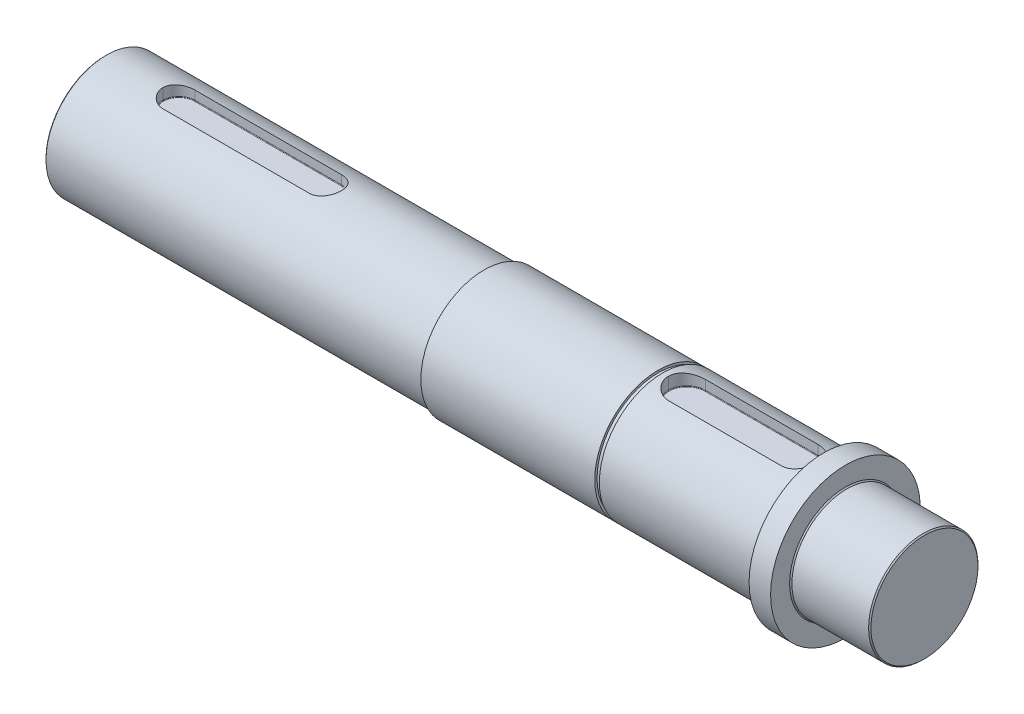
from build123d import *

# Parameters (mm, degrees)
SMUSSO1_SIZE                  = 0.5
SMUSSO2_SIZE                  = 1
TAGLIO_ESTRUSIONE1_DEPTH      = 16
TAGLIO_ESTRUSIONE1_DEPTH_BACK = 16
SCHIZZO2_W                    = 130
SCHIZZO2_H                    = 18
RACCORDO1_R                   = 0.5
RACCORDO2_R                   = 16
RACCORDO3_R                   = 2
SCHIZZO3_W                    = 4
SCHIZZO3_H                    = 18.361474643
SCHIZZO6_R                    = 52.5
ESTRUSIONE_ESTRUSIONE1_DEPTH  = 70
TAGLIO_ESTRUSIONE2_DEPTH      = 14
TAGLIO_ESTRUSIONE2_DEPTH_BACK = 14
SCHIZZO4_W                    = 155
SCHIZZO4_H                    = 16
RACCORDO4_R                   = 14
RACCORDO5_R                   = 0.5
ESTRUSIONE_ESTRUSIONE2_START  = 13
SCHIZZO7_R                    = 47.5
ESTRUSIONE_ESTRUSIONE2_DEPTH  = 13
SMUSSO3_SIZE                  = 1


with BuildPart() as part:
    # Schizzo1 → Rivoluzione1 (revolve)
    with BuildSketch(Plane.XY, mode=Mode.PRIVATE) as rivoluzione1_sk:
        Polygon((0, 0), (0, 52.5), (259, 52.5), (259, 55), (554, 55), (554, 65), (572.7, 65), (572.7, 47.5), (628.3, 47.5), (628.3, 0), align=None)
    revolve(rivoluzione1_sk.sketch.rotate(Axis((-197.2323049, 0, 0), (1, 0, 0)), 90), axis=Axis((-197.2323049, 0, 0), (1, 0, 0)))

    # Smusso1
    smusso1_edges = [part.edges().sort_by_distance(p)[0] for p in [
        (259, 0, -52.5),
    ]]
    chamfer(smusso1_edges, length=SMUSSO1_SIZE)

    # Smusso2
    smusso2_edges = [part.edges().sort_by_distance(p)[0] for p in [
        (572.7, 0, -47.5),
    ]]
    chamfer(smusso2_edges, length=SMUSSO2_SIZE)

    # Schizzo2 → Taglio-Estrusione1 (cut, two sides: drawn at the far end of the back side and taken through both)
    with BuildSketch(Plane.XY.offset(-TAGLIO_ESTRUSIONE1_DEPTH_BACK)):
        with Locations((484, 53)):
            Rectangle(SCHIZZO2_W, SCHIZZO2_H)
    extrude(amount=TAGLIO_ESTRUSIONE1_DEPTH + TAGLIO_ESTRUSIONE1_DEPTH_BACK, mode=Mode.SUBTRACT)

    # Raccordo1
    raccordo1_edges = [part.edges().sort_by_distance(p)[0] for p in [
        (549, 44, 0),
        (484, 44, 16),
        (419, 44, 0),
        (484, 44, -16),
    ]]
    fillet(raccordo1_edges, radius=RACCORDO1_R)

    # Raccordo2
    # the kernel refuses this fillet: 16 mm, written as the material it adds along each edge
    with BuildSketch(Plane(origin=(533, 44, 0), x_dir=(1, 0, 0), z_dir=(0, 0, -1))) as raccordo2_piece_1:
        with BuildLine():
            CenterArc((15.5, -0.5), 0.5, 0, 90)
            Line((16, -0.5), (16, 0))
            Line((16, 0), (15.5, 0))
        make_face()
    revolve(axis=Axis((533, 44, 0), (0, -1, 0)), revolution_arc=90)
    with BuildSketch(Plane(origin=(435, 44, 0), x_dir=(-1, 0, 0), z_dir=(0, 0, 1))) as raccordo2_piece_2:
        with BuildLine():
            CenterArc((15.5, -0.5), 0.5, 0, 90)
            Line((16, -0.5), (16, 0))
            Line((16, 0), (15.5, 0))
        make_face()
    revolve(axis=Axis((435, 44, 0), (0, -1, 0)), revolution_arc=90)
    with BuildSketch(Plane(origin=(435, 44, 0), x_dir=(0, 0, 1), z_dir=(1, 0, 0))) as raccordo2_piece_3:
        with BuildLine():
            CenterArc((15.5, -0.5), 0.5, 0, 90)
            Line((16, -0.5), (16, 0))
            Line((16, 0), (15.5, 0))
        make_face()
    revolve(axis=Axis((435, 44, 0), (0, -1, 0)), revolution_arc=90)
    with BuildSketch(Plane(origin=(533, 44, 0), x_dir=(0, 0, -1), z_dir=(-1, 0, 0))) as raccordo2_piece_4:
        with BuildLine():
            CenterArc((15.5, -0.5), 0.5, 0, 90)
            Line((16, -0.5), (16, 0))
            Line((16, 0), (15.5, 0))
        make_face()
    revolve(axis=Axis((533, 44, 0), (0, -1, 0)), revolution_arc=90)
    with BuildSketch(Plane(origin=(549, 92.621288468, -16), x_dir=(-1, 0, 0), z_dir=(0, -1, 0))) as raccordo2_piece_5_section:
        with BuildLine():
            CenterArc((RACCORDO2_R, -RACCORDO2_R), RACCORDO2_R, 90, 90)
            Line((0, -RACCORDO2_R), (0, 0))
            Line((0, 0), (RACCORDO2_R, 0))
        make_face()
    raccordo2_piece_5 = extrude(amount=48.621288468, mode=Mode.PRIVATE)
    raccordo2_piece_5 = raccordo2_piece_5 & Plane(origin=(545.534076623, 0, 0), x_dir=(0, 0, 1), z_dir=(1, 0, 0)) * Cylinder(55, 162, mode=Mode.PRIVATE)
    add(raccordo2_piece_5)
    with BuildSketch(Plane(origin=(419, 44, 16), x_dir=(0, 0, -1), z_dir=(0, 1, 0))) as raccordo2_piece_6_section:
        with BuildLine():
            CenterArc((RACCORDO2_R, -RACCORDO2_R), RACCORDO2_R, 90, 90)
            Line((0, -RACCORDO2_R), (0, 0))
            Line((0, 0), (RACCORDO2_R, 0))
        make_face()
    raccordo2_piece_6 = extrude(amount=48.621288468, mode=Mode.PRIVATE)
    raccordo2_piece_6 = raccordo2_piece_6 & Plane(origin=(422.465920441, 0, 0), x_dir=(0, 0, 1), z_dir=(1, 0, 0)) * Cylinder(55, 162, mode=Mode.PRIVATE)
    add(raccordo2_piece_6)
    with BuildSketch(Plane(origin=(419, 44, -16), x_dir=(0, 0, 1), z_dir=(0, 1, 0))) as raccordo2_piece_7_section:
        with BuildLine():
            CenterArc((RACCORDO2_R, RACCORDO2_R), RACCORDO2_R, 180, 90)
            Line((0, RACCORDO2_R), (0, 0))
            Line((0, 0), (RACCORDO2_R, 0))
        make_face()
    raccordo2_piece_7 = extrude(amount=48.621288468, mode=Mode.PRIVATE)
    raccordo2_piece_7 = raccordo2_piece_7 & Plane(origin=(422.465924893, 0, 0), x_dir=(0, 0, 1), z_dir=(1, 0, 0)) * Cylinder(55, 162, mode=Mode.PRIVATE)
    add(raccordo2_piece_7)
    with BuildSketch(Plane(origin=(549, 92.621288468, 16), x_dir=(-1, 0, 0), z_dir=(0, -1, 0))) as raccordo2_piece_8_section:
        with BuildLine():
            CenterArc((RACCORDO2_R, RACCORDO2_R), RACCORDO2_R, 180, 90)
            Line((0, RACCORDO2_R), (0, 0))
            Line((0, 0), (RACCORDO2_R, 0))
        make_face()
    raccordo2_piece_8 = extrude(amount=48.621288468, mode=Mode.PRIVATE)
    raccordo2_piece_8 = raccordo2_piece_8 & Plane(origin=(545.534073929, 0, 0), x_dir=(0, 0, 1), z_dir=(1, 0, 0)) * Cylinder(55, 162, mode=Mode.PRIVATE)
    add(raccordo2_piece_8)

    # Raccordo3
    raccordo3_edges = [part.edges().sort_by_distance(p)[0] for p in [
        (554, 0, -55),
    ]]
    fillet(raccordo3_edges, radius=RACCORDO3_R)

    # Schizzo3 → Taglia-Rivoluzione1 (revolve, cut)
    with BuildSketch(Plane.XY, mode=Mode.PRIVATE) as taglia_rivoluzione1_sk:
        with Locations((412, 62.180737322)):
            Rectangle(SCHIZZO3_W, SCHIZZO3_H)
    revolve(taglia_rivoluzione1_sk.sketch.rotate(Axis((-65.307499475, 0, 0), (1, 0, 0)), 90), axis=Axis((-65.307499475, 0, 0), (1, 0, 0)), mode=Mode.SUBTRACT)

    # Schizzo6 → Estrusione-Estrusione1 (add)
    with BuildSketch(Plane.ZY):
        Circle(SCHIZZO6_R)
    extrude(amount=ESTRUSIONE_ESTRUSIONE1_DEPTH)

    # Schizzo4 → Taglio-Estrusione2 (cut, two sides: drawn at the far end of the back side and taken through both)
    with BuildSketch(Plane.XY.offset(-TAGLIO_ESTRUSIONE2_DEPTH_BACK)):
        with Locations((57.5, 50.5)):
            Rectangle(SCHIZZO4_W, SCHIZZO4_H)
    extrude(amount=TAGLIO_ESTRUSIONE2_DEPTH + TAGLIO_ESTRUSIONE2_DEPTH_BACK, mode=Mode.SUBTRACT)

    # Raccordo4
    # the kernel refuses this fillet: 14 mm, written as the material it adds along each edge
    with BuildSketch(Plane(origin=(135, 85.598913032, 14), x_dir=(-1, 0, 0), z_dir=(0, -1, 0))) as raccordo4_piece_1_section:
        with BuildLine():
            CenterArc((RACCORDO4_R, RACCORDO4_R), RACCORDO4_R, 180, 90)
            Line((0, RACCORDO4_R), (0, 0))
            Line((0, 0), (RACCORDO4_R, 0))
        make_face()
    raccordo4_piece_1 = extrude(amount=78.098913032, mode=Mode.PRIVATE)
    raccordo4_piece_1 = raccordo4_piece_1 & Plane(origin=(131.948408204, 0, 0), x_dir=(0, 0, 1), z_dir=(1, 0, 0)) * Cylinder(52.5, 213, mode=Mode.PRIVATE)
    add(raccordo4_piece_1)
    with BuildSketch(Plane(origin=(135, 85.598913032, -14), x_dir=(0, 0, 1), z_dir=(0, -1, 0))) as raccordo4_piece_2_section:
        with BuildLine():
            CenterArc((RACCORDO4_R, RACCORDO4_R), RACCORDO4_R, 180, 90)
            Line((0, RACCORDO4_R), (0, 0))
            Line((0, 0), (RACCORDO4_R, 0))
        make_face()
    raccordo4_piece_2 = extrude(amount=78.098913032, mode=Mode.PRIVATE)
    raccordo4_piece_2 = raccordo4_piece_2 & Plane(origin=(131.948403613, 0, 0), x_dir=(0, 0, 1), z_dir=(1, 0, 0)) * Cylinder(52.5, 213, mode=Mode.PRIVATE)
    add(raccordo4_piece_2)
    with BuildSketch(Plane(origin=(-20, 7.5, 14), x_dir=(0, 0, -1), z_dir=(0, 1, 0))) as raccordo4_piece_3_section:
        with BuildLine():
            CenterArc((RACCORDO4_R, -RACCORDO4_R), RACCORDO4_R, 90, 90)
            Line((0, -RACCORDO4_R), (0, 0))
            Line((0, 0), (RACCORDO4_R, 0))
        make_face()
    raccordo4_piece_3 = extrude(amount=78.098913032, mode=Mode.PRIVATE)
    raccordo4_piece_3 = raccordo4_piece_3 & Plane(origin=(-16.8304684, 0, 0), x_dir=(0, 0, 1), z_dir=(1, 0, 0)) * Cylinder(52.5, 213, mode=Mode.PRIVATE)
    add(raccordo4_piece_3)
    with BuildSketch(Plane(origin=(-20, 7.5, -14), x_dir=(0, 0, 1), z_dir=(0, 1, 0))) as raccordo4_piece_4_section:
        with BuildLine():
            CenterArc((RACCORDO4_R, RACCORDO4_R), RACCORDO4_R, 180, 90)
            Line((0, RACCORDO4_R), (0, 0))
            Line((0, 0), (RACCORDO4_R, 0))
        make_face()
    raccordo4_piece_4 = extrude(amount=78.098913032, mode=Mode.PRIVATE)
    raccordo4_piece_4 = raccordo4_piece_4 & Plane(origin=(-16.8304684, 0, 0), x_dir=(0, 0, 1), z_dir=(1, 0, 0)) * Cylinder(52.5, 213, mode=Mode.PRIVATE)
    add(raccordo4_piece_4)

    # Raccordo5
    raccordo5_edges = [part.edges().sort_by_distance(p)[0] for p in [
        (57.5, 42.5, 14),
        (57.5, 42.5, -14),
        (-20, 42.5, 0),
        (-20, 42.5, 0),
        (135, 42.5, 0),
        (135, 42.5, 0),
    ]]
    fillet(raccordo5_edges, radius=RACCORDO5_R)

    # Schizzo7 → Estrusione-Estrusione2 (add)
    with BuildSketch(Plane(origin=(628.3, 0, 0), x_dir=(0, 0, -1), z_dir=(1, 0, 0)).offset(ESTRUSIONE_ESTRUSIONE2_START)):
        with Locations(Location((0, 0, 0), (0, 0, 180))):
            Circle(SCHIZZO7_R)
    extrude(amount=-ESTRUSIONE_ESTRUSIONE2_DEPTH)

    # Smusso3
    smusso3_edges = [part.edges().sort_by_distance(p)[0] for p in [
        (-70, 0, -52.5),
        (641.3, 0, -47.5),
    ]]
    chamfer(smusso3_edges, length=SMUSSO3_SIZE)


solid = part.part
